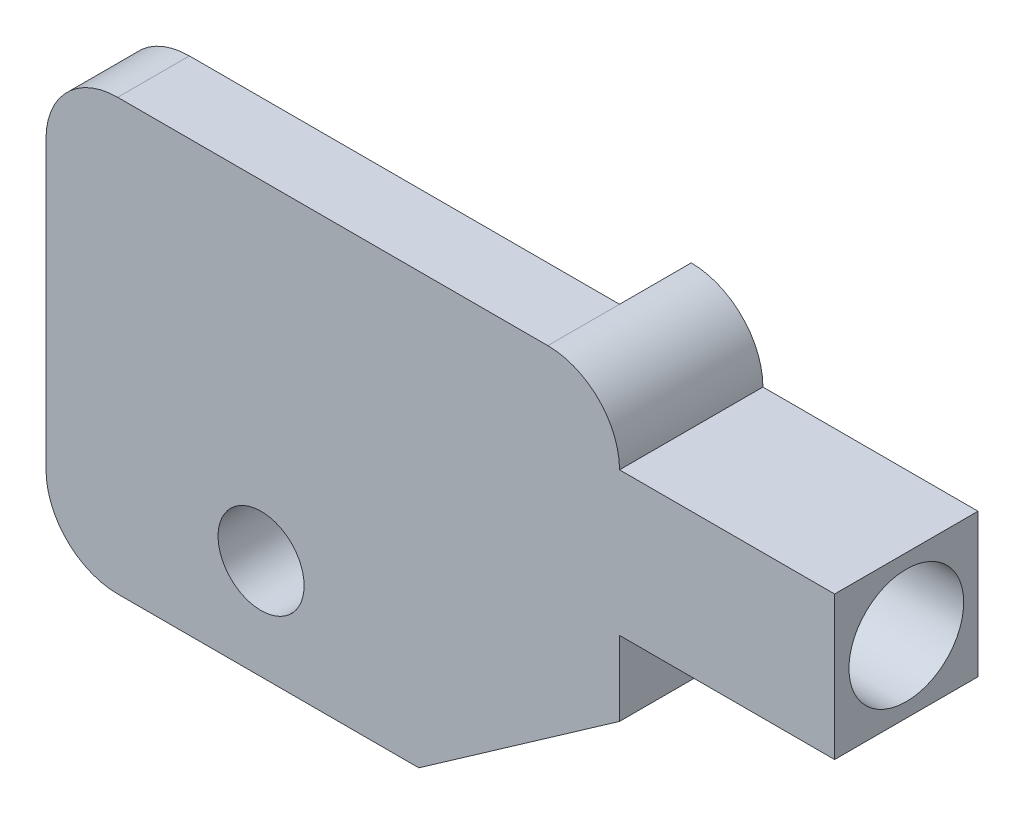
from build123d import *

# Parameters (mm, degrees)
SKETCH2_W           = 50.8
SKETCH2_H           = 38.1
BOSS_EXTRUDE1_DEPTH = 12.7
FILLET1_R           = 6.35
SKETCH3_R           = 3.81
CUT_EXTRUDE1_DEPTH  = 35.195796525
SKETCH7_W           = 12.7
SKETCH7_H           = 12.7
BOSS_EXTRUDE2_DEPTH = 19.05
SKETCH8_R           = 5.08
CUT_EXTRUDE2_DEPTH  = 25.4
SKETCH9_W           = 6.35
SKETCH9_H           = 38.1
CUT_EXTRUDE3_DEPTH  = 44.45
CUT_EXTRUDE4_REACH  = 52
SKETCH10_W          = 6.35
SKETCH10_H          = 6.35
CHAMFER6_SIZE       = 17.78
CHAMFER6_SIZE_2     = 12.449690029


with BuildPart() as part:
    # Sketch2 → Boss-Extrude1 (new body)
    with BuildSketch(Plane.XY):
        Rectangle(SKETCH2_W, SKETCH2_H)
    extrude(amount=BOSS_EXTRUDE1_DEPTH)

    # Fillet1
    fillet1_edges = [part.edges().sort_by_distance(p)[0] for p in [
        (-25.4, 19.05, 6.35),
        (25.4, 19.05, 6.35),
        (-25.4, -19.05, 6.35),
    ]]
    fillet(fillet1_edges, radius=FILLET1_R)

    # Sketch3 → Cut-Extrude1 (cut, through all)
    with BuildSketch(Plane.XY.offset(12.7)):
        with Locations((-6.35, -10.16)):
            Circle(SKETCH3_R)
    extrude(amount=-CUT_EXTRUDE1_DEPTH, mode=Mode.SUBTRACT)

    # Sketch7 → Boss-Extrude2 (add)
    with BuildSketch(Plane(origin=(25.4, 0, 0), x_dir=(0, 0, -1), z_dir=(1, 0, 0))):
        with Locations((-6.35, 6.35)):
            Rectangle(SKETCH7_W, SKETCH7_H)
    extrude(amount=BOSS_EXTRUDE2_DEPTH)

    # Sketch8 → Cut-Extrude2 (cut)
    with BuildSketch(Plane(origin=(44.45, 0, 0), x_dir=(0, 0, -1), z_dir=(1, 0, 0))):
        with Locations((-6.35, 6.35)):
            Circle(SKETCH8_R)
    extrude(amount=-CUT_EXTRUDE2_DEPTH, mode=Mode.SUBTRACT)

    # Sketch9 → Cut-Extrude3 (cut)
    with BuildSketch(Plane.ZY.offset(25.4)):
        with Locations((3.175, 0)):
            Rectangle(SKETCH9_W, SKETCH9_H)
    extrude(amount=-CUT_EXTRUDE3_DEPTH, mode=Mode.SUBTRACT)

    # Sketch10 → Cut-Extrude4 (cut, up to next)
    with BuildSketch(Plane.ZY.offset(-19.05), mode=Mode.PRIVATE) as cut_extrude4_sk1:
        with Locations((3.175, -15.875)):
            Rectangle(SKETCH10_W, SKETCH10_H)
    cut_extrude4_tool1 = extrude(cut_extrude4_sk1.sketch, amount=-CUT_EXTRUDE4_REACH, mode=Mode.PRIVATE) & part.part
    add(cut_extrude4_tool1.solids().sort_by_distance((19.05, -15.875, 3.175))[0], mode=Mode.SUBTRACT)

    # Chamfer6
    # the kernel refuses this chamfer: 17.78, 12.449690029 mm, written as the material it takes off along each edge
    with BuildSketch(Plane(origin=(25.4, -19.05, -39.567778654), x_dir=(-0.9997533347641299, -0.022209674198457294, 0), z_dir=(0, 0, 1))) as chamfer6_piece_1:
        Polygon((CHAMFER6_SIZE * 0.999753334764, -CHAMFER6_SIZE * 0.0222096741985), (-CHAMFER6_SIZE_2 * 0.0222096741991, -CHAMFER6_SIZE_2 * 0.999753334794), (0, 0), align=None)
    extrude(amount=98.185557309, mode=Mode.SUBTRACT)


solid = part.part
